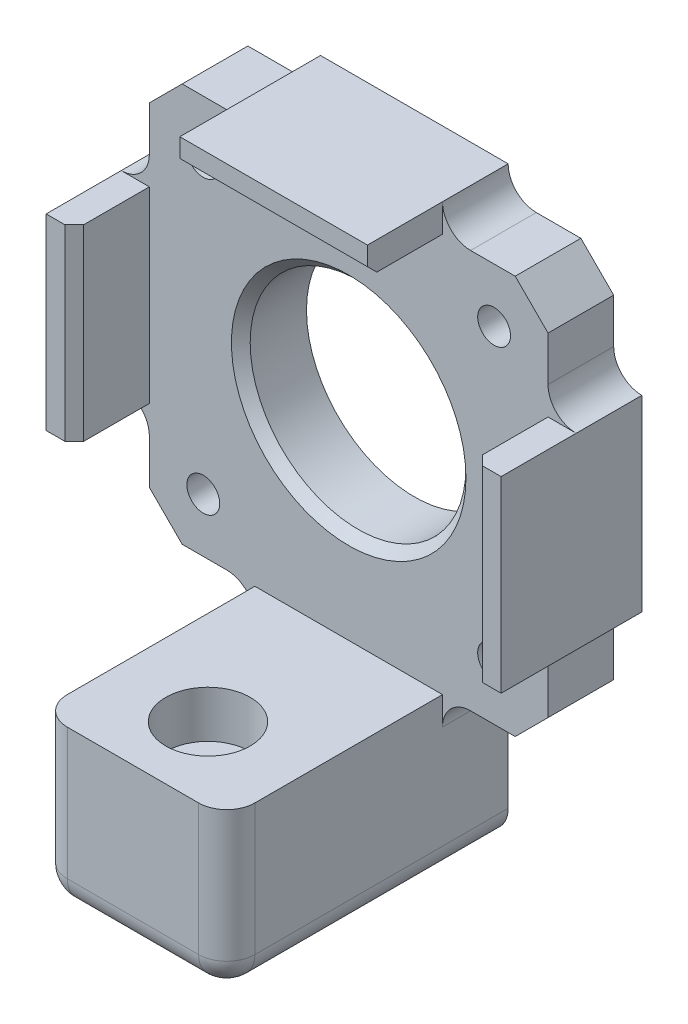
from build123d import *

# Parameters (mm, degrees)
ESQUISSE1_R             = 11.5
ESQUISSE1_R_2           = 1.75
BOSS_EXTRU_1_DEPTH      = 7
ESQUISSE2_W             = 20
ESQUISSE2_H             = 3
ESQUISSE2_W_2           = 3
ESQUISSE2_H_2           = 20
BOSS_EXTRU_2_DEPTH      = 15
ESQUISSE3_W             = 20
ESQUISSE3_H             = 17
BOSS_EXTRU_3_DEPTH      = 30
ESQUISSE4_R             = 2.5
ENL_V_MAT_EXTRU_1_DEPTH = 60.651592602
ESQUISSE5_R             = 4.5
ENL_V_MAT_EXTRU_2_DEPTH = 5
ENL_V_MAT_EXTRU_3_DEPTH = 10
CONG_1_R                = 3
CONG_2_R                = 3
CHANFREIN1_SIZE         = 1


with BuildPart() as part:
    # Esquisse1 → Boss.-Extru.1 (new body)
    with BuildSketch(Plane.XY):
        Polygon((-17.749999999, 21.249999999), (-21.249999999, 17.749999999), (-21.249999999, -17.749999999), (-17.749999999, -21.250000001), (17.749999999, -21.250000001), (21.249999999, -17.749999999), (21.249999999, 17.749999999), (17.749999999, 21.249999999), align=None)
        Circle(ESQUISSE1_R, mode=Mode.SUBTRACT)
        with Locations((-15.5, 15.5)):
            Circle(ESQUISSE1_R_2, mode=Mode.SUBTRACT)
        with Locations((15.5, 15.5)):
            Circle(ESQUISSE1_R_2, mode=Mode.SUBTRACT)
        with Locations((15.5, -15.5)):
            Circle(ESQUISSE1_R_2, mode=Mode.SUBTRACT)
        with Locations((-15.5, -15.5)):
            Circle(ESQUISSE1_R_2, mode=Mode.SUBTRACT)
    extrude(amount=BOSS_EXTRU_1_DEPTH)

    # Esquisse2 → Boss.-Extru.2 (add)
    with BuildSketch(Plane(origin=(0, 0, 0), x_dir=(-1, 0, 0), z_dir=(0, 0, -1))):
        with Locations((0, 22.749999999)):
            Rectangle(ESQUISSE2_W, ESQUISSE2_H)
        with Locations((22.749999999, 0)):
            Rectangle(ESQUISSE2_W_2, ESQUISSE2_H_2)
        with Locations((-22.749999999, 0)):
            Rectangle(ESQUISSE2_W_2, ESQUISSE2_H_2)
    extrude(amount=-BOSS_EXTRU_2_DEPTH)

    # Esquisse3 → Boss.-Extru.3 (add)
    with BuildSketch(Plane(origin=(0, 0, 0), x_dir=(-1, 0, 0), z_dir=(0, 0, -1))):
        with Locations((0, -29.750000001)):
            Rectangle(ESQUISSE3_W, ESQUISSE3_H)
    extrude(amount=-BOSS_EXTRU_3_DEPTH)

    # Esquisse4 → Enlèv. mat.-Extru.1 (cut, through all)
    with BuildSketch(Plane(origin=(0, -21.250000001, 0), x_dir=(1, 0, 0), z_dir=(0, 1, 0))):
        with Locations(Location((0, -22, 0), (0, 0, 270))):
            Circle(ESQUISSE4_R)
    extrude(amount=-ENL_V_MAT_EXTRU_1_DEPTH, mode=Mode.SUBTRACT)

    # Esquisse5 → Enlèv. mat.-Extru.2 (cut)
    with BuildSketch(Plane(origin=(0, -21.250000001, 0), x_dir=(1, 0, 0), z_dir=(0, 1, 0))):
        with Locations(Location((0, -22, 0), (0, 0, 270))):
            Circle(ESQUISSE5_R)
    extrude(amount=-ENL_V_MAT_EXTRU_2_DEPTH, mode=Mode.SUBTRACT)

    # Esquisse6 → Enlèv. mat.-Extru.3 (cut)
    with BuildSketch(Plane(origin=(0, -38.250000001, 0), x_dir=(-1, 0, 0), z_dir=(0, -1, 0))):
        with BuildLine():
            Line((3.010398645, -19), (-3.010398645, -19))
            ThreePointArc((-3.010398645, -19), (0, -26.25), (3.010398645, -19))
        make_face()
    extrude(amount=-ENL_V_MAT_EXTRU_3_DEPTH, mode=Mode.SUBTRACT)

    # Congé1
    cong_1_edges = [part.edges().sort_by_distance(p)[0] for p in [
        (-21.249999999, -10, 3.5),
        (-21.249999999, 10, 3.5),
        (-10, 21.249999999, 3.5),
        (10, 21.249999999, 3.5),
        (21.249999999, 10, 3.5),
        (21.249999999, -10, 3.5),
        (-10, -38.250000001, 15),
        (10, -38.250000001, 15),
        (10, -21.250000001, 3.5),
        (-10, -21.250000001, 3.5),
    ]]
    fillet(cong_1_edges, radius=CONG_1_R - 0.0001)  # a hair under: the kernel refuses the full size

    # Congé2
    cong_2_edges = [part.edges().sort_by_distance(p)[0] for p in [
        (-10, -28.250050001, 30),
        (0, -38.250000001, 30),
        (9.121349633, -37.371349634, 30),
        (-9.121349633, -37.371349634, 30),
        (10, -28.250050001, 30),
    ]]
    fillet(cong_2_edges, radius=CONG_2_R - 0.0001)  # a hair under: the kernel refuses the full size

    # Chanfrein1
    chanfrein1_edges = [part.edges().sort_by_distance(p)[0] for p in [
        (-11.5, 0, 7),
        (0, 21.249999999, 15),
        (-21.249999999, 0, 15),
        (21.249999999, 0, 15),
    ]]
    chamfer(chanfrein1_edges, length=CHANFREIN1_SIZE)


solid = part.part
